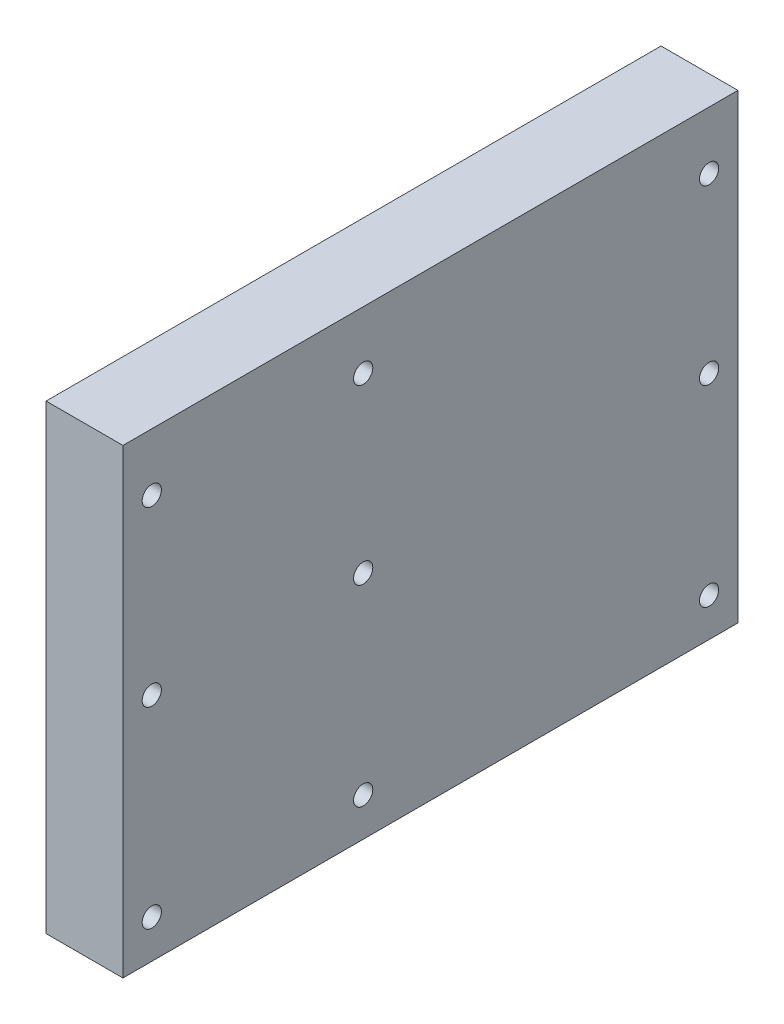
from build123d import *

# Parameters (mm, degrees)
SKETCH1_W           = 203.2
SKETCH1_H           = 152.4
SKETCH1_R           = 3.175
BOSS_EXTRUDE1_DEPTH = 25.4


with BuildPart() as part:
    # Sketch1 → Boss-Extrude1 (new body)
    with BuildSketch(Plane(origin=(0, 0, 0), x_dir=(0, 0, -1), z_dir=(1, 0, 0))):
        Rectangle(SKETCH1_W, SKETCH1_H)
        with Locations((-22.225, 57.15)):
            Circle(SKETCH1_R, mode=Mode.SUBTRACT)
        with Locations((-22.225, 0)):
            Circle(SKETCH1_R, mode=Mode.SUBTRACT)
        with Locations((-92.075, 0)):
            Circle(SKETCH1_R, mode=Mode.SUBTRACT)
        with Locations((-92.075, 57.15)):
            Circle(SKETCH1_R, mode=Mode.SUBTRACT)
        with Locations((92.075, 57.15)):
            Circle(SKETCH1_R, mode=Mode.SUBTRACT)
        with Locations((92.075, 0)):
            Circle(SKETCH1_R, mode=Mode.SUBTRACT)
        with Locations((-22.225, -63.5)):
            Circle(SKETCH1_R, mode=Mode.SUBTRACT)
        with Locations((-92.075, -63.5)):
            Circle(SKETCH1_R, mode=Mode.SUBTRACT)
        with Locations((92.075, -63.5)):
            Circle(SKETCH1_R, mode=Mode.SUBTRACT)
    extrude(amount=BOSS_EXTRUDE1_DEPTH)


solid = part.part
